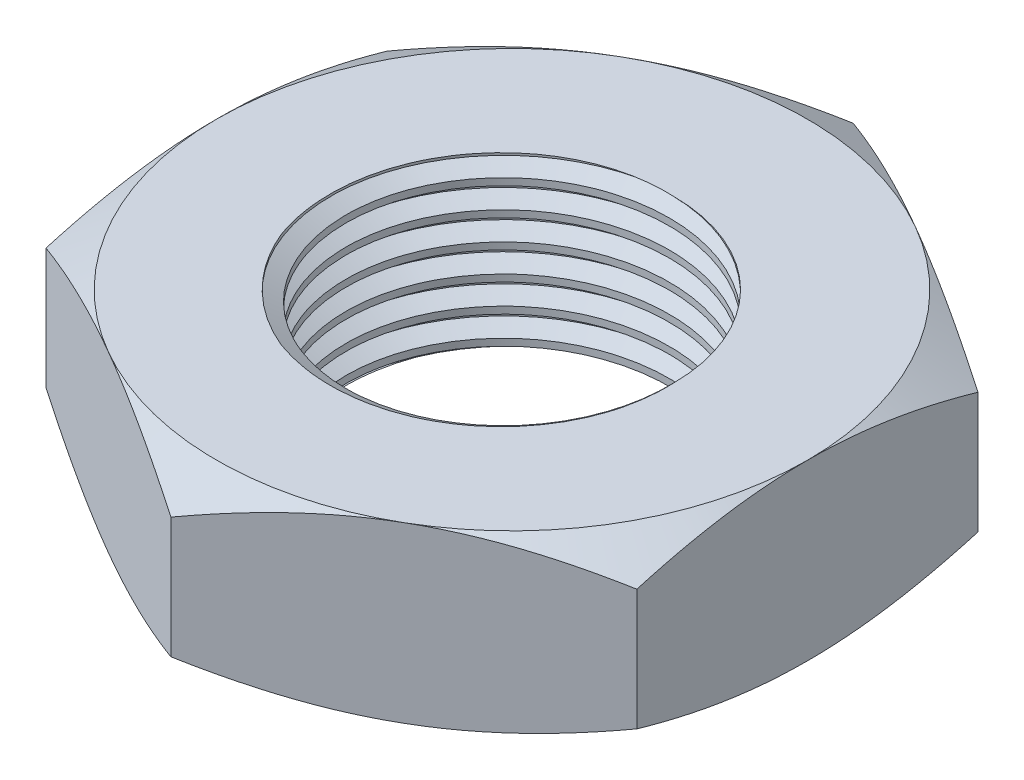
from build123d import *

# Parameters (mm, degrees)
BOSS_EXTRUDE1_DEPTH      = 2.5
M5_CLEARANCE_HOLE1_D     = 9.3
M5_CLEARANCE_HOLE1_DEPTH = 12
M5_CLEARANCE_HOLE1_TIP   = 2.794001878
THREAD1_PITCH            = 0.8
SKETCH5_OUTSIDE_W        = 75.95
SKETCH5_OUTSIDE_H        = 78.58
SKETCH5_OUTSIDE_R        = 8.5
CUT_EXTRUDE2_DEPTH       = 14.913422943
CUT_EXTRUDE2_DRAFT       = -60
MIRROR1_COPY_1_SKETCH_W  = 75.95
MIRROR1_COPY_1_SKETCH_H  = 78.58
MIRROR1_COPY_1_SKETCH_R  = 8.5
MIRROR1_COPY_1_DEPTH     = 14.913422943
MIRROR1_COPY_1_DRAFT     = -60


with BuildPart() as part:
    # Sketch1 → Boss-Extrude1 (new, symmetric)
    with BuildSketch(Plane(origin=(0, 0, 0), x_dir=(1, 0, 0), z_dir=(0, 1, 0))):
        Polygon((-8.5, 4.907477288), (-8.5, -4.907477288), (0, -9.814954576), (8.5, -4.907477288), (8.5, 4.907477288), (0, 9.814954576), align=None)
    extrude(amount=BOSS_EXTRUDE1_DEPTH, both=True)

    # M5 Clearance Hole1
    with Locations(Plane.ZX.offset(2.5)):
        with Locations((0, 0)):
            Hole(M5_CLEARANCE_HOLE1_D / 2, depth=M5_CLEARANCE_HOLE1_DEPTH)
            with Locations((0, 0, -(M5_CLEARANCE_HOLE1_DEPTH + M5_CLEARANCE_HOLE1_TIP / 2))):  # 118° drill point
                Cone(0, M5_CLEARANCE_HOLE1_D / 2, M5_CLEARANCE_HOLE1_TIP, mode=Mode.SUBTRACT)

    # Thread1: the profile of Thread Profile2 profile screwed along a right-hand helix of 10 turns, 8 arcs to a turn; built about Z, then put on its axis
    thread1_z = Axis((0, 0, 0), (0, 0, 1))
    thread1_corners = [(4.6497, 0, -0.000173205), (5.0830127, 0, 0.249999999), (5.0830127, 0, 0.349999999), (4.6497, 0, 0.600173203)]
    with BuildLine(mode=Mode.PRIVATE) as thread1_profile:
        Line(thread1_corners[0], thread1_corners[1])
        Line(thread1_corners[1], thread1_corners[2])
        Line(thread1_corners[2], thread1_corners[3])
        Line(thread1_corners[3], thread1_corners[0])
    thread1_cap = Face(thread1_profile.wire())
    thread1_turn_angles = [0, 22.5, 45, 67.5, 90, 112.5, 135, 157.5, 180, 202.5, 225, 247.5, 270, 292.5, 315, 337.5, 360]
    thread1_turn_weights = [1, 0.9238795325112867, 1, 0.9238795325112867, 1, 0.9238795325112867, 1, 0.9238795325112867, 1, 0.9238795325112867, 1, 0.9238795325112867, 1, 0.9238795325112867, 1, 0.9238795325112867, 1]
    thread1_turn_rails = [Edge.make_bspline([Vector(p[0], p[1], 0).rotate(thread1_z, thread1_turn_angles[k]) / thread1_turn_weights[k] + Vector(0, 0, p[2] + THREAD1_PITCH * thread1_turn_angles[k] / 360) for k in range(17)], [0, 0, 0, 1, 1, 2, 2, 3, 3, 4, 4, 5, 5, 6, 6, 7, 7, 8, 8, 8], 2, thread1_turn_weights) for p in thread1_corners]
    thread1_turn_sides = [Face.make_surface_from_curves(thread1_turn_rails[p[0]], thread1_turn_rails[p[1]]) for p in [(0, 1), (1, 2), (2, 3), (3, 0)]]
    thread1 = Plane(origin=(0, 3.5, 0), x_dir=(-1, 0, 0), z_dir=(0, -1, 0)) * Solid(Shell([*[p.moved(Location((0, 0, THREAD1_PITCH * i))) for i in range(10) for p in thread1_turn_sides], thread1_cap, thread1_cap.rotate(thread1_z, 3600).moved(Location((0, 0, THREAD1_PITCH * 3600 / 360)))]))
    add(thread1, mode=Mode.SUBTRACT)


with BuildPart() as cut_extrude2_tool:
    # Sketch5 outside → Cut-Extrude2 (with draft: the straight prism first)
    with BuildSketch(Plane(origin=(0, 2.5, 0), x_dir=(1, 0, 0), z_dir=(0, 1, 0))):
        Rectangle(SKETCH5_OUTSIDE_W, SKETCH5_OUTSIDE_H)
        Circle(SKETCH5_OUTSIDE_R, mode=Mode.SUBTRACT)
    extrude(amount=-CUT_EXTRUDE2_DEPTH)
    # Cut-Extrude2: the draft: its side faces are tilted about the plane it starts from
    cut_extrude2_sides = [cut_extrude2_tool.faces().sort_by_distance(p)[0] for p in [
        (0, -4.956711472, 39.29),
        (37.975, -4.956711472, 0),
        (0, -4.956711472, -39.29),
        (-37.975, -4.956711472, 0),
        (-8.5, -4.956711472, 0),
    ]]
    draft(cut_extrude2_sides, Plane(origin=(0, 2.5, 0), x_dir=(1, 0, 0), z_dir=(0, 1, 0)), CUT_EXTRUDE2_DRAFT)


with BuildPart() as part_1:
    add(part.part)

    # Cut-Extrude2: cut by cut_extrude2_tool
    add(cut_extrude2_tool.part, mode=Mode.SUBTRACT)


with BuildPart() as mirror1_copy_1_tool:
    # Mirror1 copy 1 sketch → Mirror1 copy 1 (with draft: the straight prism first)
    with BuildSketch(Plane.XZ.offset(2.5)):
        Rectangle(MIRROR1_COPY_1_SKETCH_W, MIRROR1_COPY_1_SKETCH_H)
        Circle(MIRROR1_COPY_1_SKETCH_R, mode=Mode.SUBTRACT)
    extrude(amount=-MIRROR1_COPY_1_DEPTH)
    # Mirror1 copy 1: the draft: its side faces are tilted about the plane it starts from
    mirror1_copy_1_sides = [mirror1_copy_1_tool.faces().sort_by_distance(p)[0] for p in [
        (0, 4.956711472, 39.29),
        (37.975, 4.956711472, 0),
        (0, 4.956711472, -39.29),
        (-37.975, 4.956711472, 0),
        (-8.5, 4.956711472, 0),
    ]]
    draft(mirror1_copy_1_sides, Plane.XZ.offset(2.5), MIRROR1_COPY_1_DRAFT)


with BuildPart() as part_2:
    add(part_1.part)

    # Mirror1 copy 1: cut by mirror1_copy_1_tool
    add(mirror1_copy_1_tool.part, mode=Mode.SUBTRACT)


solid = part_2.part
